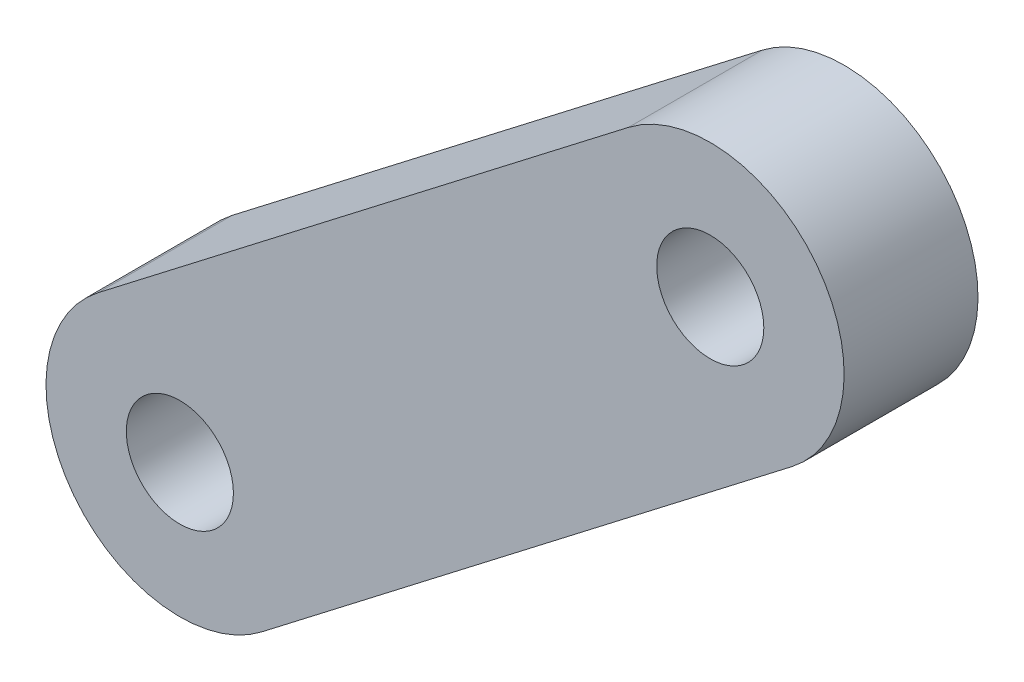
from build123d import *

# Parameters (mm, degrees)
SKETCH1_R           = 2
BOSS_EXTRUDE1_DEPTH = 5
SKETCH2_R           = 2
BOSS_EXTRUDE2_DEPTH = 5


with BuildPart() as part:
    # Sketch1 → Boss-Extrude1 (new body)
    with BuildSketch(Plane(origin=(0, 0, 0), x_dir=(0.9997573026985189, -0.022030335925312537, 0), z_dir=(0, 0, 1))):
        with BuildLine():
            Line((-29.904437649, 103.275259833), (-49.372163993, 87.590629426))
            ThreePointArc((-49.372163993, 87.590629426), (-50.12878318, 80.560158076), (-43.09831183, 79.803538889))
            Line((-43.09831183, 79.803538889), (-23.630585486, 95.488169295))
            ThreePointArc((-23.630585486, 95.488169295), (-23.225758684, 95.852410595), (-22.86294507, 96.25851741))
            ThreePointArc((-22.86294507, 96.25851741), (-23.238207598, 102.923467448), (-29.904437649, 103.275259833))
        make_face()
        with Locations((-46.235237911, 83.697084158)):
            Circle(SKETCH1_R, mode=Mode.SUBTRACT)
        with Locations((-26.767511567, 99.381714564)):
            Circle(SKETCH1_R, mode=Mode.SUBTRACT)
    extrude(amount=BOSS_EXTRUDE1_DEPTH)


with BuildPart() as body_2:
    # Sketch2 → Boss-Extrude2 (new body)
    with BuildSketch(Plane(origin=(0, 0, 0), x_dir=(-1, 0, 0), z_dir=(0, 0, -1))):
        with Locations((44.380141864, 84.695348924)):
            Circle(SKETCH2_R)
    extrude(amount=BOSS_EXTRUDE2_DEPTH)


solid = Compound([part.part, body_2.part])
